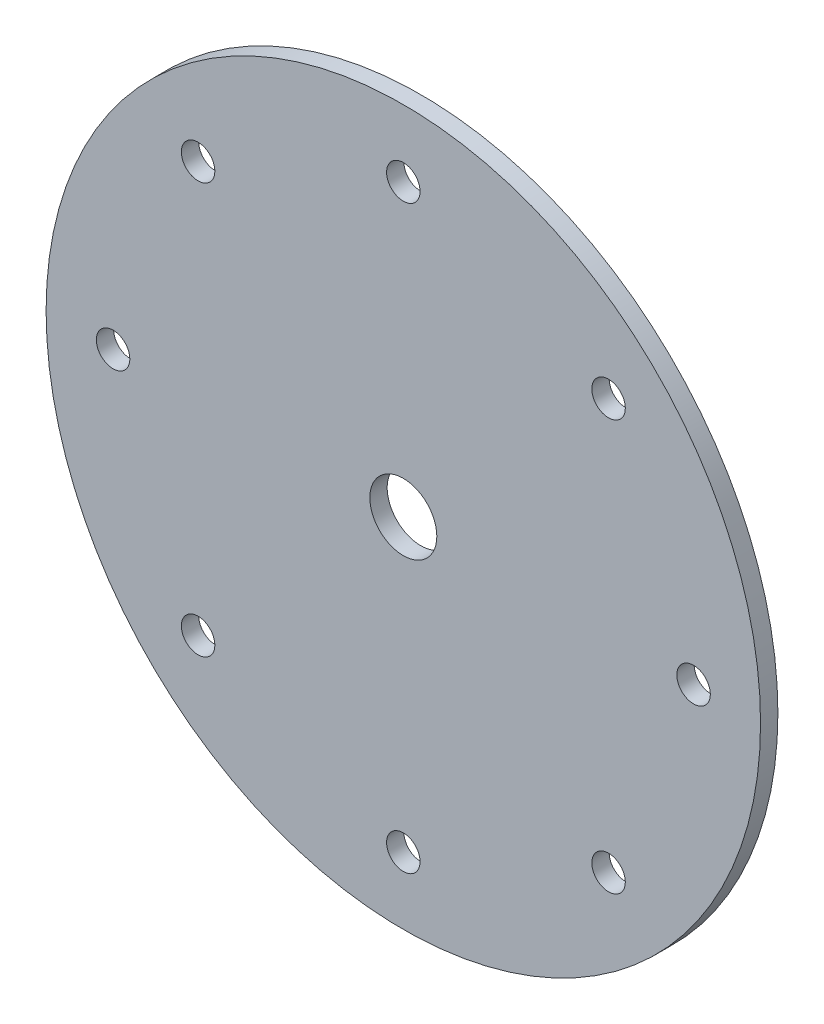
from build123d import *

# Parameters (mm, degrees)
SKETCH1_R        = 101.6
SKETCH1_R_2      = 4.7625
SKETCH1_R_3      = 9.525
ROTOR_DISC_DEPTH = 4.93522


with BuildPart() as part:
    # Sketch1 → Rotor Disc (new body)
    with BuildSketch(Plane.XY):
        Circle(SKETCH1_R)
        with Locations((-58.371664787, -58.371664787)):
            Circle(SKETCH1_R_2, mode=Mode.SUBTRACT)
        with Locations((-82.55, 0)):
            Circle(SKETCH1_R_2, mode=Mode.SUBTRACT)
        Circle(SKETCH1_R_3, mode=Mode.SUBTRACT)
        with Locations((0, -82.55)):
            Circle(SKETCH1_R_2, mode=Mode.SUBTRACT)
        with Locations((58.371664787, -58.371664787)):
            Circle(SKETCH1_R_2, mode=Mode.SUBTRACT)
        with Locations((-58.371664787, 58.371664787)):
            Circle(SKETCH1_R_2, mode=Mode.SUBTRACT)
        with Locations((0, 82.55)):
            Circle(SKETCH1_R_2, mode=Mode.SUBTRACT)
        with Locations((82.55, 0)):
            Circle(SKETCH1_R_2, mode=Mode.SUBTRACT)
        with Locations((58.371664787, 58.371664787)):
            Circle(SKETCH1_R_2, mode=Mode.SUBTRACT)
    extrude(amount=ROTOR_DISC_DEPTH)


solid = part.part
